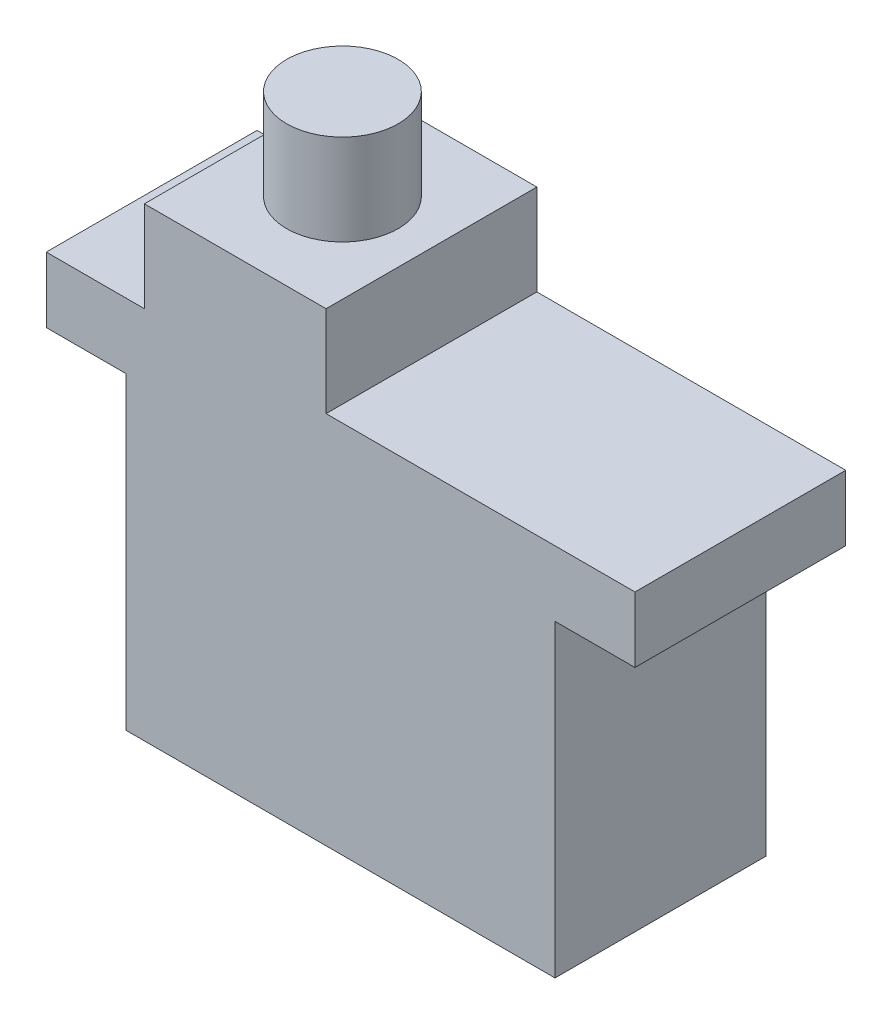
from build123d import *

# Parameters (mm, degrees)
SKETCH1_W           = 23.6
SKETCH1_H           = 11.6
BOSS_EXTRUDE1_DEPTH = 17
SKETCH2_W           = 32.4
SKETCH2_H           = 11.6
BOSS_EXTRUDE2_DEPTH = 3.6
SKETCH3_W           = 10
SKETCH3_H           = 11.6
BOSS_EXTRUDE3_DEPTH = 5
SKETCH4_R           = 3.071074645
BOSS_EXTRUDE4_DEPTH = 5


with BuildPart() as part:
    # Sketch1 → Boss-Extrude1 (new body)
    with BuildSketch(Plane(origin=(0, 0, 0), x_dir=(1, 0, 0), z_dir=(0, 1, 0))):
        Rectangle(SKETCH1_W, SKETCH1_H)
    extrude(amount=BOSS_EXTRUDE1_DEPTH)

    # Sketch2 → Boss-Extrude2 (add)
    with BuildSketch(Plane(origin=(0, 17, 0), x_dir=(1, 0, 0), z_dir=(0, 1, 0))):
        Rectangle(SKETCH2_W, SKETCH2_H)
    extrude(amount=BOSS_EXTRUDE2_DEPTH)

    # Sketch3 → Boss-Extrude3 (add)
    with BuildSketch(Plane(origin=(0, 20.6, 0), x_dir=(1, 0, 0), z_dir=(0, 1, 0))):
        with Locations((-5.8, 0)):
            Rectangle(SKETCH3_W, SKETCH3_H)
    extrude(amount=BOSS_EXTRUDE3_DEPTH)

    # Sketch4 → Boss-Extrude4 (add)
    with BuildSketch(Plane(origin=(0, 25.6, 0), x_dir=(1, 0, 0), z_dir=(0, 1, 0))):
        with Locations((-5.7, 0)):
            Circle(SKETCH4_R)
    extrude(amount=BOSS_EXTRUDE4_DEPTH)


solid = part.part
